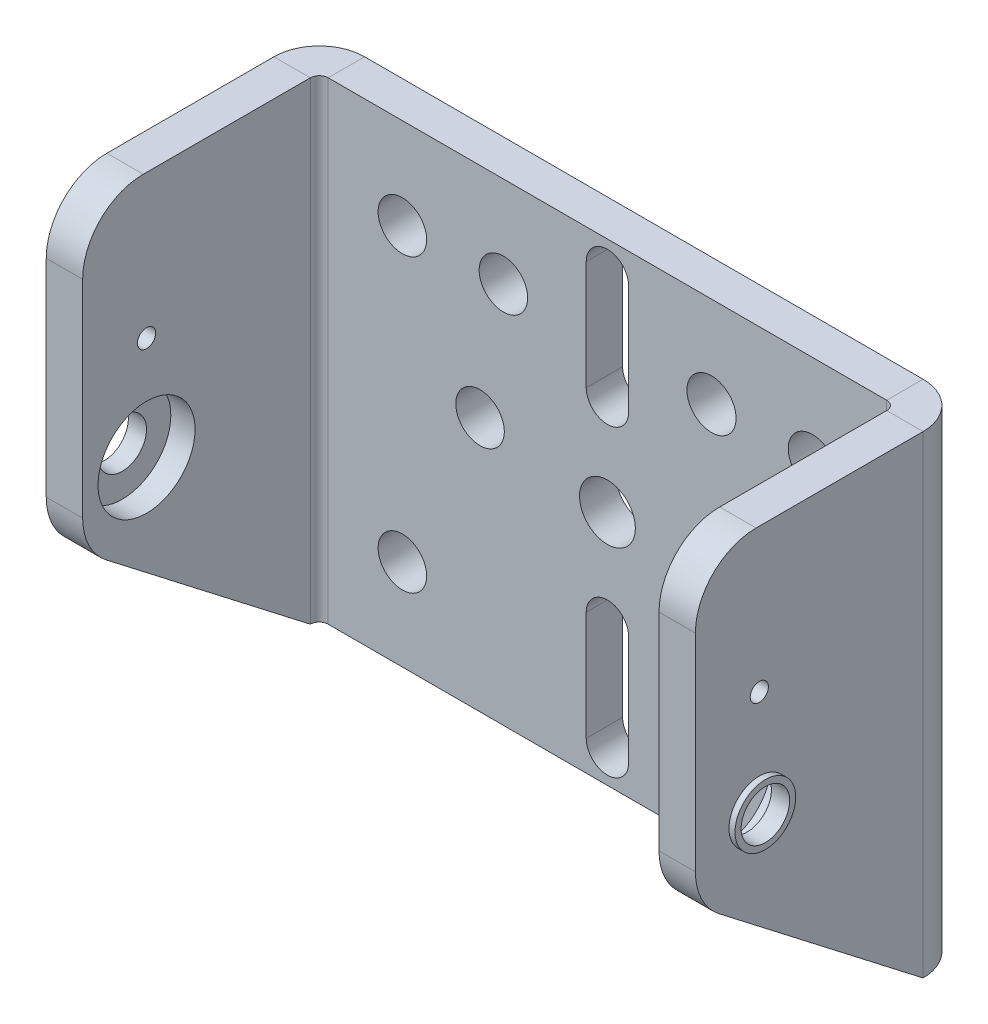
from build123d import *

# Parameters (mm, degrees)
ESBO_O1_W                        = 47.5
ESBO_O1_H                        = 39
FLANGE_BASE1_DEPTH               = 3
ESBO_O6_R                        = 2.3
CORTE_EXTRUS_O1_DEPTH            = 10
ARESTA_FLANGE1_STRIP_W           = 13.4732
ARESTA_FLANGE1_STRIP_H           = 3
ARESTA_FLANGE1_STRIP_CUT_DEPTH   = 39
ARESTA_FLANGE1_STRIP_2_W         = 13.4732
ARESTA_FLANGE1_STRIP_2_H         = 3
ARESTA_FLANGE1_STRIP_CUT_2_DEPTH = 39
ARESTA_FLANGE1_DEPTH             = 39
ARESTA_FLANGE1_BEND_DEPTH        = 39
ESBO_O13_R                       = 2
ESBO_O13_R_2                     = 0.75
CORTE_EXTRUS_O2_DEPTH            = 70
FILETE1_R                        = 5
ESBO_O14_R                       = 1.997873176
ESBO_O14_R_2                     = 2.026064888
ESBO_O14_R_3                     = 2
CORTE_EXTRUS_O4_DEPTH            = 3
BOSS_EXTRUDE1_START              = 0.5
SKETCH1_R                        = 2.5
SKETCH1_R_2                      = 2
BOSS_EXTRUDE1_DEPTH              = 0.5
SKETCH2_R                        = 4
CUT_EXTRUDE8_DEPTH               = 2


# Sheet-metal steps are written as plain solids
with BuildPart() as part:
    # Esboço1 → Flange-base1 (new body)
    with BuildSketch(Plane.XY):
        with Locations((3.243735783, -4.490936556)):
            Rectangle(ESBO_O1_W, ESBO_O1_H)
    extrude(amount=-FLANGE_BASE1_DEPTH)

    # Esboço6 → Corte-extrusão1 (cut)
    with BuildSketch(Plane.XY):
        with BuildLine():
            Line((-13.656264217, 5.509063444), (-13.656264217, 7.509063444))
            Line((-13.656264217, 7.509063444), (-11.656264217, 7.509063444))
            ThreePointArc((-11.656264217, 7.509063444), (-15.070477779, 8.923277006), (-13.656264217, 5.509063444))
        make_face()
        with BuildLine():
            Line((-11.656264217, 7.509063444), (-13.656264217, 7.509063444))
            Line((-13.656264217, 7.509063444), (-13.656264217, 5.509063444))
            ThreePointArc((-13.656264217, 5.509063444), (-12.242050654, 6.094849882), (-11.656264217, 7.509063444))
        make_face()
        with BuildLine():
            ThreePointArc((-11.656264217, -16.490936556), (-12.242050654, -15.076722994), (-13.656264217, -14.490936556))
            Line((-13.656264217, -14.490936556), (-13.656264217, -16.490936556))
            Line((-13.656264217, -16.490936556), (-11.656264217, -16.490936556))
        make_face()
        with BuildLine():
            Line((-13.656264217, -16.490936556), (-13.656264217, -14.490936556))
            ThreePointArc((-13.656264217, -14.490936556), (-15.070477779, -17.905150118), (-11.656264217, -16.490936556))
            Line((-11.656264217, -16.490936556), (-13.656264217, -16.490936556))
        make_face()
        with Locations((3.243735783, -4.490936556)):
            Circle(ESBO_O6_R)
        with BuildLine():
            Line((4.993735783, 7.509063444), (1.493735783, 7.509063444))
            Line((1.493735783, 7.509063444), (1.493735783, 3.523823043))
            ThreePointArc((1.493735783, 3.523823043), (3.243735783, 1.773823043), (4.993735783, 3.523823043))
            Line((4.993735783, 3.523823043), (4.993735783, 7.509063444))
        make_face()
        with BuildLine():
            Line((1.493735783, 12.523823043), (1.493735783, 7.509063444))
            Line((1.493735783, 7.509063444), (4.993735783, 7.509063444))
            Line((4.993735783, 7.509063444), (4.993735783, 12.523823043))
            ThreePointArc((4.993735783, 12.523823043), (3.243735783, 14.273823043), (1.493735783, 12.523823043))
        make_face()
        with BuildLine():
            Line((1.493735783, -12.505696155), (1.493735783, -16.490936556))
            Line((1.493735783, -16.490936556), (4.993735783, -16.490936556))
            Line((4.993735783, -16.490936556), (4.993735783, -12.505696155))
            ThreePointArc((4.993735783, -12.505696155), (3.243735783, -10.755696155), (1.493735783, -12.505696155))
        make_face()
        with BuildLine():
            Line((4.993735783, -16.490936556), (1.493735783, -16.490936556))
            Line((1.493735783, -16.490936556), (1.493735783, -21.505696155))
            ThreePointArc((1.493735783, -21.505696155), (3.243735783, -23.255696155), (4.993735783, -21.505696155))
            Line((4.993735783, -21.505696155), (4.993735783, -16.490936556))
        make_face()
        with BuildLine():
            ThreePointArc((22.143735783, -16.490936556), (21.557949346, -15.076722994), (20.143735783, -14.490936556))
            Line((20.143735783, -14.490936556), (20.143735783, -16.490936556))
            Line((20.143735783, -16.490936556), (18.143735783, -16.490936556))
            ThreePointArc((18.143735783, -16.490936556), (20.143735783, -18.490936556), (22.143735783, -16.490936556))
        make_face()
        with BuildLine():
            Line((20.143735783, -16.490936556), (20.143735783, -14.490936556))
            ThreePointArc((20.143735783, -14.490936556), (18.729522221, -15.076722994), (18.143735783, -16.490936556))
            Line((18.143735783, -16.490936556), (20.143735783, -16.490936556))
        make_face()
        with BuildLine():
            ThreePointArc((22.143735783, 7.509063444), (20.143735783, 9.509063444), (18.143735783, 7.509063444))
            Line((18.143735783, 7.509063444), (20.143735783, 7.509063444))
            Line((20.143735783, 7.509063444), (20.143735783, 5.509063444))
            ThreePointArc((20.143735783, 5.509063444), (21.557949346, 6.094849882), (22.143735783, 7.509063444))
        make_face()
        with BuildLine():
            Line((20.143735783, 7.509063444), (18.143735783, 7.509063444))
            ThreePointArc((18.143735783, 7.509063444), (18.729522221, 6.094849882), (20.143735783, 5.509063444))
            Line((20.143735783, 5.509063444), (20.143735783, 7.509063444))
        make_face()
    extrude(amount=-CORTE_EXTRUS_O1_DEPTH, mode=Mode.SUBTRACT)

    # Aresta-Flange1 strip (across the edge) → Aresta-Flange1 strip cut (cut)
    with BuildSketch(Plane(origin=(26.993735783, -23.990936556, 0), x_dir=(-1, 0, 0), z_dir=(0, 1, 0))):
        with Locations((-6, -1.5)):
            Rectangle(ARESTA_FLANGE1_STRIP_W, ARESTA_FLANGE1_STRIP_H)
    extrude(amount=ARESTA_FLANGE1_STRIP_CUT_DEPTH, mode=Mode.SUBTRACT)

    # Aresta-Flange1 strip 2 (across the edge) → Aresta-Flange1 strip cut 2 (cut)
    with BuildSketch(Plane(origin=(-20.506264217, 15.009063444, 0), x_dir=(1, 0, 0), z_dir=(0, -1, 0))):
        with Locations((-6, -1.5)):
            Rectangle(ARESTA_FLANGE1_STRIP_2_W, ARESTA_FLANGE1_STRIP_2_H)
    extrude(amount=ARESTA_FLANGE1_STRIP_CUT_2_DEPTH, mode=Mode.SUBTRACT)

    # Aresta-Flange1 section (across the edge) → Aresta-Flange1 (add)
    with BuildSketch(Plane(origin=(26.993735783, -23.990936556, 0), x_dir=(-1, 0, 0), z_dir=(0, 1, 0))):
        with BuildLine():
            Line((-3, 0.7366), (-3, 19.5))
            Line((-3, 19.5), (0, 19.5))
            Line((0, 19.5), (0, 0.7366))
            ThreePointArc((0, 0.7366), (0.215745145, 0.215745145), (0.7366, 0))
            Line((0.7366, 0), (0.7366, -3))
            ThreePointArc((0.7366, -3), (-1.905575199, -1.905575199), (-3, 0.7366))
        make_face()
    extrude(amount=ARESTA_FLANGE1_DEPTH)

    # Aresta-Flange1 section 2 (across the edge) → Aresta-Flange1 bend (add)
    with BuildSketch(Plane(origin=(-20.506264217, 15.009063444, 0), x_dir=(1, 0, 0), z_dir=(0, -1, 0))):
        with BuildLine():
            Line((-3, 0.7366), (-3, 19.5))
            Line((-3, 19.5), (0, 19.5))
            Line((0, 19.5), (0, 0.7366))
            ThreePointArc((0, 0.7366), (0.215745145, 0.215745145), (0.7366, 0))
            Line((0.7366, 0), (0.7366, -3))
            ThreePointArc((0.7366, -3), (-1.905575199, -1.905575199), (-3, 0.7366))
        make_face()
    extrude(amount=ARESTA_FLANGE1_BEND_DEPTH)

    # Esboço13 → Corte-extrusão2 (cut)
    with BuildSketch(Plane.ZY.offset(23.506264217)):
        with Locations((14.234737, -5.325205188)):
            Circle(ESBO_O13_R)
        with Locations((14.234737, 3.174794812)):
            Circle(ESBO_O13_R_2)
        Polygon((0.7366, -23.990936556), (19.5, -23.990936556), (19.5, -9.490936556), align=None)
    extrude(amount=-CORTE_EXTRUS_O2_DEPTH, mode=Mode.SUBTRACT)

    # Filete1
    filete1_edges = [part.edges().sort_by_distance(p)[0] for p in [
        (28.493735783, 15.009063444, 19.5),
        (-22.006264217, 15.009063444, 19.5),
        (-22.006264217, -9.490936556, 19.5),
        (28.493735783, -9.490936556, 19.5),
    ]]
    fillet(filete1_edges, radius=FILETE1_R)

    # Esboço14 → Corte-extrusão4 (cut)
    with BuildSketch(Plane.XY):
        with Locations((-5.331264217, 7.509063444)):
            Circle(ESBO_O14_R)
        with Locations((11.818735783, 7.509063444)):
            Circle(ESBO_O14_R_2)
        with Locations((13.743735783, -2.990936556)):
            Circle(ESBO_O14_R_3)
        with Locations(Location((-7.256264217, -2.990936556, 0), (0, 0, 180))):
            Circle(ESBO_O14_R_3)
    extrude(amount=-CORTE_EXTRUS_O4_DEPTH, mode=Mode.SUBTRACT)

    # Sketch1 → Boss-Extrude1 (add)
    with BuildSketch(Plane.ZY.offset(23.506264217).offset(BOSS_EXTRUDE1_START)):
        with Locations(Location((14.234737, -5.325205188, 0), (0, 0, 180))):
            Circle(SKETCH1_R)
        with Locations((14.234737, -5.325205188)):
            Circle(SKETCH1_R_2, mode=Mode.SUBTRACT)
    boss_extrude1 = extrude(amount=-BOSS_EXTRUDE1_DEPTH)

    # Sketch2 → Cut-Extrude8 (cut)
    with BuildSketch(Plane(origin=(-20.506264217, 0, 0), x_dir=(0, 0, -1), z_dir=(1, 0, 0))):
        with Locations((-14.234737, -5.325205188)):
            Circle(SKETCH2_R)
    cut_extrude8 = extrude(amount=-CUT_EXTRUDE8_DEPTH, mode=Mode.SUBTRACT)

    # Mirror1: Boss-Extrude1, Cut-Extrude8 across plane
    add(boss_extrude1.mirror(Plane.ZY.offset(-3.243735783)))
    add(cut_extrude8.mirror(Plane.ZY.offset(-3.243735783)), mode=Mode.SUBTRACT)


solid = part.part
